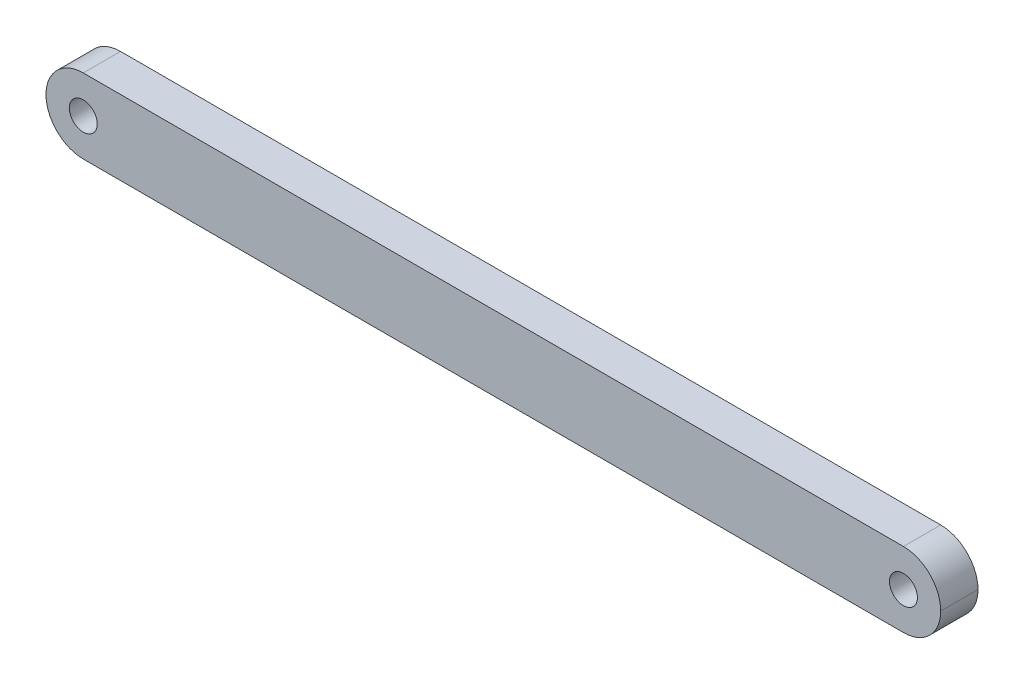
from build123d import *

# Parameters (mm, degrees)
SKETCH1_W           = 152.4
SKETCH1_H           = 12.7
BOSS_EXTRUDE1_DEPTH = 6.35
FILLET1_R           = 6.35
SKETCH2_R           = 2.38125
CUT_EXTRUDE1_DEPTH  = 25.4


with BuildPart() as part:
    # Sketch1 → Boss-Extrude1 (new body)
    with BuildSketch(Plane.XY):
        with Locations((76.2, 6.35)):
            Rectangle(SKETCH1_W, SKETCH1_H)
    extrude(amount=BOSS_EXTRUDE1_DEPTH)

    # Fillet1
    fillet1_edges = [part.edges().sort_by_distance(p)[0] for p in [
        (0, 0, 3.175),
        (0, 12.7, 3.175),
        (152.4, 0, 3.175),
        (152.4, 12.7, 3.175),
    ]]
    fillet(fillet1_edges, radius=FILLET1_R - 0.0001)  # a hair under: the kernel refuses the full size

    # Sketch2 → Cut-Extrude1 (cut)
    with BuildSketch(Plane.XY.offset(6.35)):
        with Locations((6.35, 6.35)):
            Circle(SKETCH2_R)
        with Locations((146.05, 6.35)):
            Circle(SKETCH2_R)
    extrude(amount=-CUT_EXTRUDE1_DEPTH, mode=Mode.SUBTRACT)


solid = part.part
